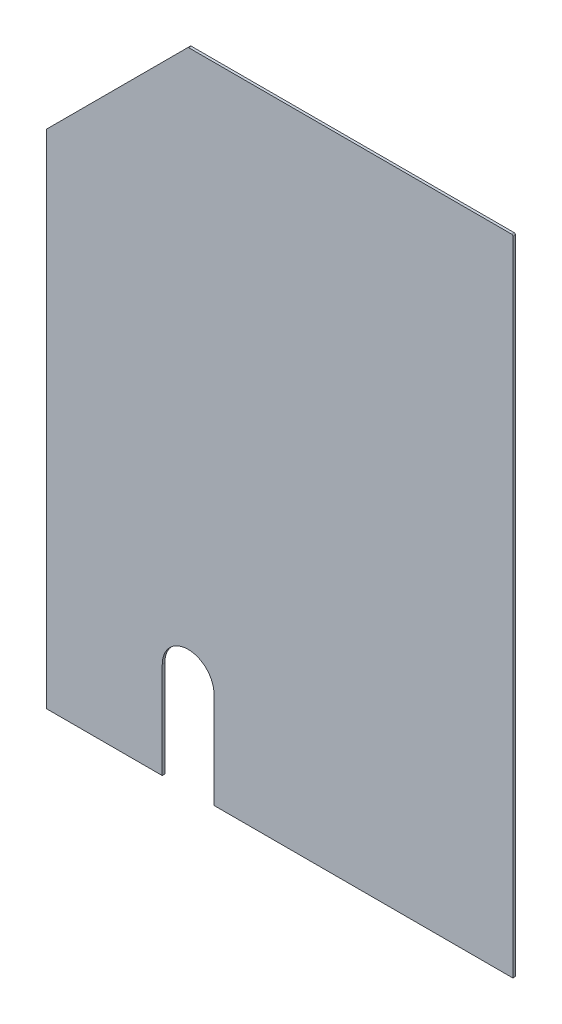
from build123d import *

# Parameters (mm, degrees)
SM_BASE_FLANGE_1_DEPTH = 1.5


# Sheet-metal steps are written as plain solids
with BuildPart() as part:
    # Sketch 1 → Базовая кромка1 (new body)
    with BuildSketch(Plane.XY):
        with BuildLine():
            Line((-270.076706029, 290.501117881), (-270.076706029, 0))
            Line((-270.076706029, 0), (-203.076706029, 0))
            Line((-203.076706029, 0), (-203.076706029, 55.811778053))
            ThreePointArc((-203.076706029, 55.811778053), (-188.076706029, 70.811778053), (-173.076706029, 55.811778053))
            Line((-173.076706029, 55.811778053), (-173.076706029, 0))
            Line((-173.076706029, 0), (0, 0))
            Line((0, 0), (0, 372.061778053))
            ThreePointArc((0, 372.061778053), (-0.219669914, 372.592108139), (-0.75, 372.811778053))
            Line((-0.75, 372.811778053), (-187.766045857, 372.811778053))
            ThreePointArc((-187.766045857, 372.811778053), (-188.053058432, 372.754687702), (-188.296375943, 372.592108139))
            Line((-188.296375943, 372.592108139), (-269.857036115, 291.031447967))
            ThreePointArc((-269.857036115, 291.031447967), (-270.019615678, 290.788130455), (-270.076706029, 290.501117881))
        make_face()
    extrude(amount=-SM_BASE_FLANGE_1_DEPTH)


solid = part.part
